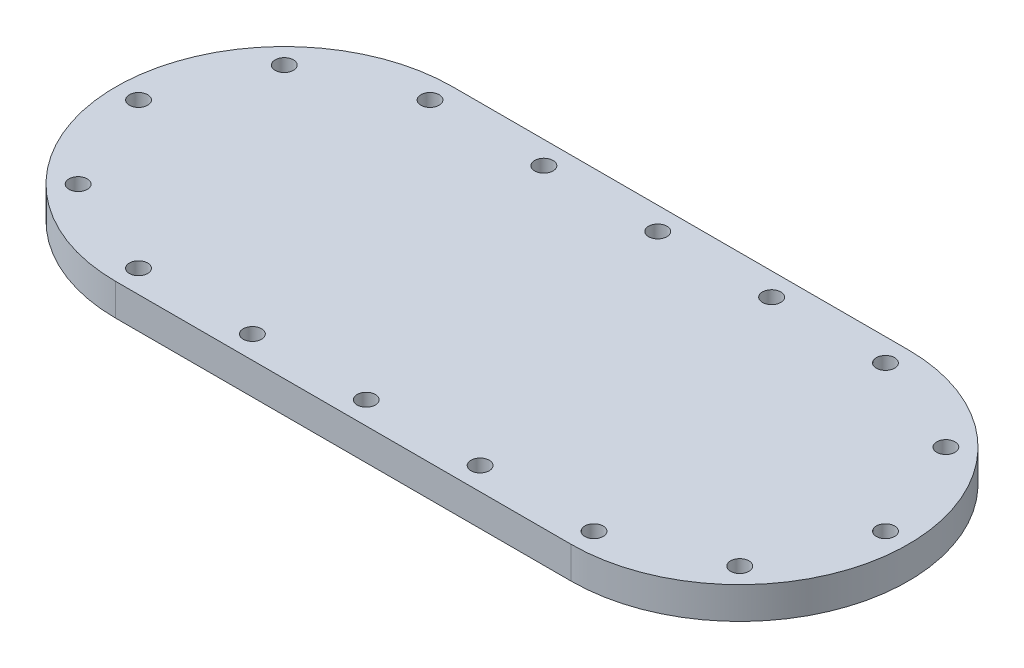
from build123d import *

# Parameters (mm, degrees)
SKETCH1_R           = 2.5527
BOSS_EXTRUDE1_DEPTH = 8.89


with BuildPart() as part:
    # Sketch1 → Boss-Extrude1 (new body)
    with BuildSketch(Plane(origin=(0, 0, 0), x_dir=(1, 0, 0), z_dir=(0, 1, 0))):
        with BuildLine():
            Line((63.5, 46.99), (-63.5, 46.99))
            ThreePointArc((-63.5, 46.99), (-110.49, 0), (-63.5, -46.99))
            Line((-63.5, -46.99), (63.5, -46.99))
            ThreePointArc((63.5, -46.99), (110.49, 0), (63.5, 46.99))
        make_face()
        with Locations((-63.5, -40.64)):
            Circle(SKETCH1_R, mode=Mode.SUBTRACT)
        with Locations((-92.236819587, -28.736819587)):
            Circle(SKETCH1_R, mode=Mode.SUBTRACT)
        with Locations((-31.75, -40.64)):
            Circle(SKETCH1_R, mode=Mode.SUBTRACT)
        with Locations((-104.14, 0)):
            Circle(SKETCH1_R, mode=Mode.SUBTRACT)
        with Locations((0, -40.64)):
            Circle(SKETCH1_R, mode=Mode.SUBTRACT)
        with Locations((31.75, -40.64)):
            Circle(SKETCH1_R, mode=Mode.SUBTRACT)
        with Locations((63.5, -40.64)):
            Circle(SKETCH1_R, mode=Mode.SUBTRACT)
        with Locations((92.236819587, -28.736819587)):
            Circle(SKETCH1_R, mode=Mode.SUBTRACT)
        with Locations((-92.236819587, 28.736819587)):
            Circle(SKETCH1_R, mode=Mode.SUBTRACT)
        with Locations((-63.5, 40.64)):
            Circle(SKETCH1_R, mode=Mode.SUBTRACT)
        with Locations((-31.75, 40.64)):
            Circle(SKETCH1_R, mode=Mode.SUBTRACT)
        with Locations((104.14, 0)):
            Circle(SKETCH1_R, mode=Mode.SUBTRACT)
        with Locations((0, 40.64)):
            Circle(SKETCH1_R, mode=Mode.SUBTRACT)
        with Locations((31.75, 40.64)):
            Circle(SKETCH1_R, mode=Mode.SUBTRACT)
        with Locations((92.236819587, 28.736819587)):
            Circle(SKETCH1_R, mode=Mode.SUBTRACT)
        with Locations((63.5, 40.64)):
            Circle(SKETCH1_R, mode=Mode.SUBTRACT)
    extrude(amount=BOSS_EXTRUDE1_DEPTH)


solid = part.part
